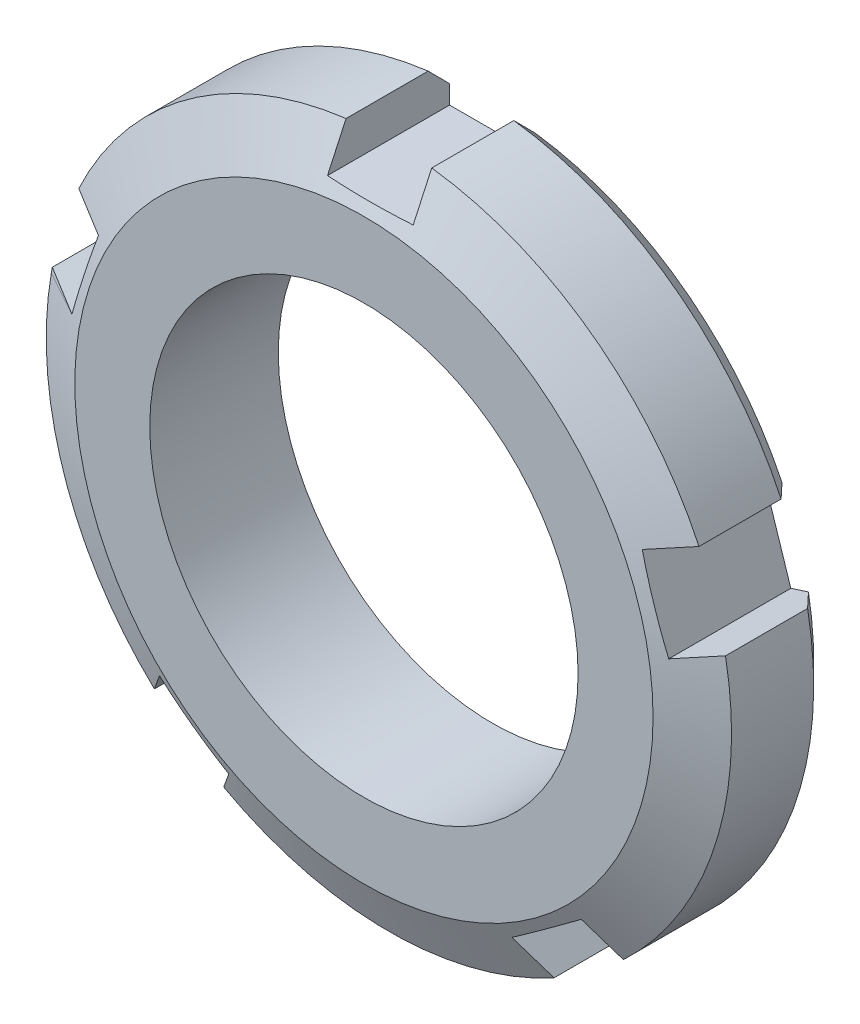
from build123d import *

# Parameters (mm, degrees)
SKETCH2_W          = 4
SKETCH2_H          = 2
CUT_EXTRUDE1_DEPTH = 24.409399821
CIRPATTERN1_COUNT  = 5


with BuildPart() as part:
    # Sketch1 → Revolve1 (revolve)
    with BuildSketch(Plane(origin=(0, 0, 0), x_dir=(0, 0, -1), z_dir=(1, 0, 0))):
        Polygon((0, 10), (6, 10), (6, 15), (5, 16), (1.165769145, 16), (0, 13.5), align=None)
    revolve(axis=Axis((0, 0, 16.345177665), (0, 0, -1)))

    # Sketch2 → Cut-Extrude1 (cut, through all)
    with BuildSketch(Plane.XY):
        with Locations((0, 15)):
            Rectangle(SKETCH2_W, SKETCH2_H)
    cut_extrude1 = extrude(amount=-CUT_EXTRUDE1_DEPTH, mode=Mode.SUBTRACT)

    # CirPattern1: Cut-Extrude1 ×5 about axis
    cirpattern1_axis = Axis((0, 0, 16.345177665), (0, 0, 1))
    for i in range(1, CIRPATTERN1_COUNT):
        add(cut_extrude1.rotate(cirpattern1_axis, i * 360 / CIRPATTERN1_COUNT), mode=Mode.SUBTRACT)


solid = part.part
